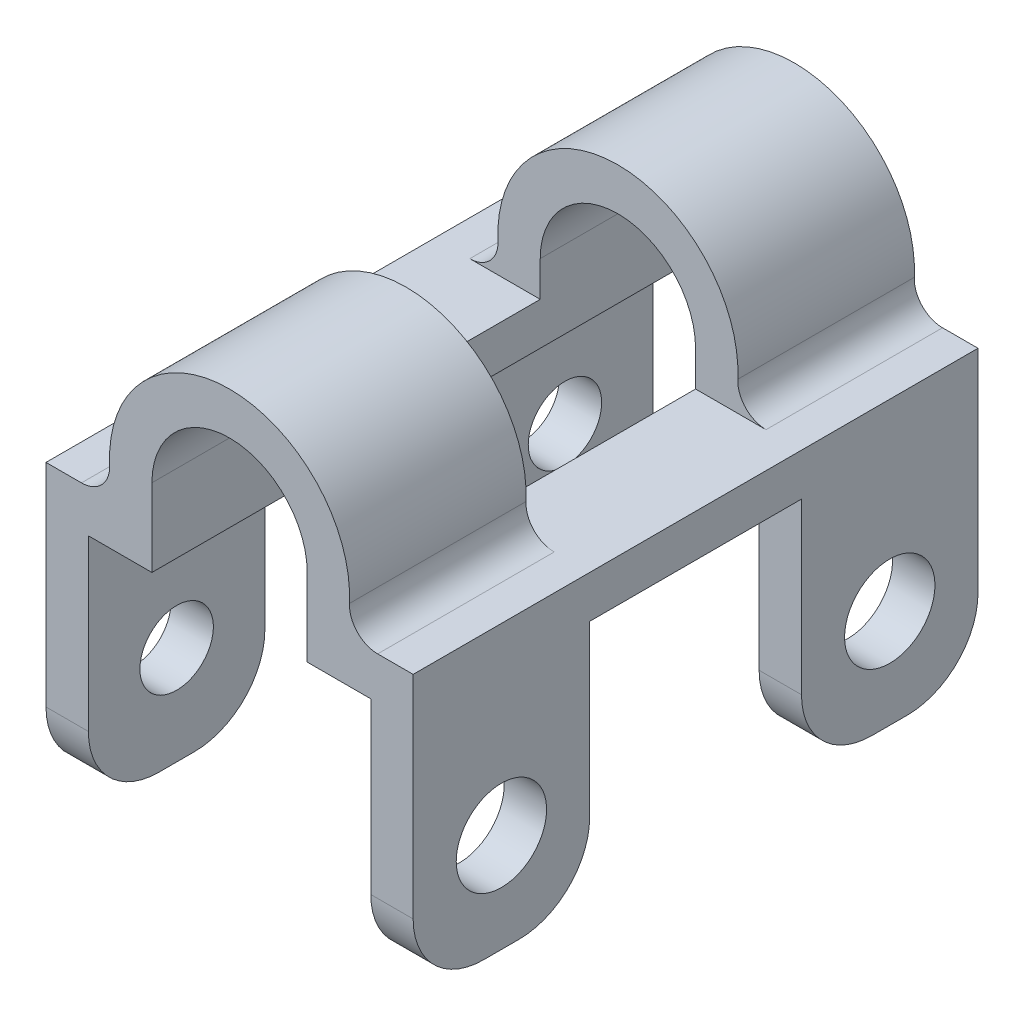
from build123d import *

# Parameters (mm, degrees)
EXTRUDE_1_DEPTH     = 10
SKETCH_2_W          = 10
SKETCH_2_H          = 7.5
SKETCH_2_W_2        = 1.5
CUT_EXTRUDE_1_DEPTH = 10
CUT_EXTRUDE_START   = -1.5
SKETCH_3_W          = 13
SKETCH_3_H          = 7.5
CUT_EXTRUDE_2_DEPTH = 20
CUT_EXTRUDE_3_REACH = 17.564
SKETCH_4_W          = 5.5
SKETCH_4_H          = 20
FILLET_1_R          = 2.5
FILLET_2_R          = 1
SKETCH_5_R          = 1.6
CUT_EXTRUDE_4_DEPTH = 20
MOVE_START          = -6.5
MOVE_FACE_1_DEPTH   = 13
MOVE_FACE_2_BY      = 0.3
MOVE_FACE_2_2_BY    = 0.3


# Read off the part's stored shape, not the designer's step: 面の移動1
with BuildPart() as part:
    # ｽｹｯﾁ1 → ﾎﾞｽ - 押し出し1 (new, symmetric)
    with BuildSketch(Plane.XY):
        with BuildLine():
            Line((-5, 5), (5, 5))
            Line((5, 5), (5, -5))
            Line((5, -5), (6.5, -5))
            Line((6.5, -5), (6.5, 6.5))
            Line((6.5, 6.5), (4.062019202, 6.5))
            ThreePointArc((4.062019202, 6.5), (0, 12), (-4.062019202, 6.5))
            Line((-4.062019202, 6.5), (-6.5, 6.5))
            Line((-6.5, 6.5), (-6.5, -5))
            Line((-6.5, -5), (-5, -5))
            Line((-5, -5), (-5, 5))
        make_face()
        with BuildLine():
            Line((2.449489743, 6.5), (-2.449489743, 6.5))
            ThreePointArc((-2.449489743, 6.5), (0, 10.5), (2.449489743, 6.5))
        make_face(mode=Mode.SUBTRACT)
    extrude(amount=EXTRUDE_1_DEPTH, both=True)

    # ｽｹｯﾁ2 → ｶｯﾄ - 押し出し1 (cut)
    with BuildSketch(Plane.XZ.offset(5)):
        Rectangle(SKETCH_2_W, SKETCH_2_H)
        with Locations((-5.75, 0)):
            Rectangle(SKETCH_2_W_2, SKETCH_2_H)
        with Locations((5.75, 0)):
            Rectangle(SKETCH_2_W_2, SKETCH_2_H)
    extrude(amount=-CUT_EXTRUDE_1_DEPTH, mode=Mode.SUBTRACT)

    # ｽｹｯﾁ3 → ｶｯﾄ - 押し出し2 (cut)
    with BuildSketch(Plane.XZ.offset(-5).offset(CUT_EXTRUDE_START)):
        Rectangle(SKETCH_3_W, SKETCH_3_H)
    extrude(amount=-CUT_EXTRUDE_2_DEPTH, mode=Mode.SUBTRACT)

    # ｽｹｯﾁ4 → ｶｯﾄ - 押し出し3 (cut, up to next)
    with BuildSketch(Plane.XZ.offset(-5), mode=Mode.PRIVATE) as cut_extrude_3_sk1:
        Rectangle(SKETCH_4_W, SKETCH_4_H)
    cut_extrude_3_tool1 = extrude(cut_extrude_3_sk1.sketch, amount=-CUT_EXTRUDE_3_REACH, mode=Mode.PRIVATE) & part.part
    add(cut_extrude_3_tool1.solids().sort_by_distance((0, 5, 0))[0], mode=Mode.SUBTRACT)

    # ﾌｨﾚｯﾄ1
    fillet_1_edges = [part.edges().sort_by_distance(p)[0] for p in [
        (5.75, -5, -10),
        (-5.75, -5, -10),
        (-5.75, -5, 10),
        (-5.75, -5, -3.75),
        (-5.75, -5, 3.75),
        (5.75, -5, -3.75),
        (5.75, -5, 3.75),
        (5.75, -5, 10),
    ]]
    fillet(fillet_1_edges, radius=FILLET_1_R)

    # ﾌｨﾚｯﾄ2
    fillet_2_edges = [part.edges().sort_by_distance(p)[0] for p in [
        (-4.062019202, 6.5, 6.875),
        (4.062019202, 6.5, 6.875),
        (-4.062019202, 6.5, -6.875),
        (4.062019202, 6.5, -6.875),
    ]]
    fillet(fillet_2_edges, radius=FILLET_2_R)

    # ｽｹｯﾁ5 → ｶｯﾄ - 押し出し4 (cut)
    with BuildSketch(Plane.ZY.offset(6.5)):
        with Locations((-6.875, 0)):
            Circle(SKETCH_5_R)
    cut_extrude_4 = extrude(amount=-CUT_EXTRUDE_4_DEPTH, mode=Mode.SUBTRACT)

    # ﾐﾗｰ1: ｶｯﾄ - 押し出し4 across plane
    add(cut_extrude_4.mirror(Plane.XY), mode=Mode.SUBTRACT)

    # Move Face 1 outline → Move Face 1 (cut)
    with BuildSketch(Plane.YZ.offset(MOVE_START)):
        with BuildLine():
            ThreePointArc((-1, 3.75), (-2.767766953, 4.482233047), (-3.5, 6.25))
            Line((-3.5, 6.25), (-3.5, 7.5))
            ThreePointArc((-3.5, 7.5), (-2.767766953, 9.267766953), (-1, 10))
            Line((-1, 10), (-2.5, 10))
            ThreePointArc((-2.5, 10), (-4.267766953, 9.267766953), (-5, 7.5))
            Line((-5, 7.5), (-5, 6.25))
            ThreePointArc((-5, 6.25), (-4.267766953, 4.482233047), (-2.5, 3.75))
            Line((-2.5, 3.75), (-1, 3.75))
        make_face()
        with BuildLine():
            ThreePointArc((-1, -10), (-2.767766953, -9.267766953), (-3.5, -7.5))
            Line((-3.5, -7.5), (-3.5, -6.25))
            ThreePointArc((-3.5, -6.25), (-2.767766953, -4.482233047), (-1, -3.75))
            Line((-1, -3.75), (-2.5, -3.75))
            ThreePointArc((-2.5, -3.75), (-4.267766953, -4.482233047), (-5, -6.25))
            Line((-5, -6.25), (-5, -7.5))
            ThreePointArc((-5, -7.5), (-4.267766953, -9.267766953), (-2.5, -10))
            Line((-2.5, -10), (-1, -10))
        make_face()
    extrude(amount=MOVE_FACE_1_DEPTH, mode=Mode.SUBTRACT)

    # Move Face 2: a curved face moved outward by 0.3
    add(Solid.thicken(part.faces().sort_by_distance((-5.75, 0, -8.475))[0], MOVE_FACE_2_BY))

    # Move Face 2 2: a curved face moved outward by 0.3
    add(Solid.thicken(part.faces().sort_by_distance((-5.75, 0, 8.475))[0], MOVE_FACE_2_2_BY))


solid = part.part
